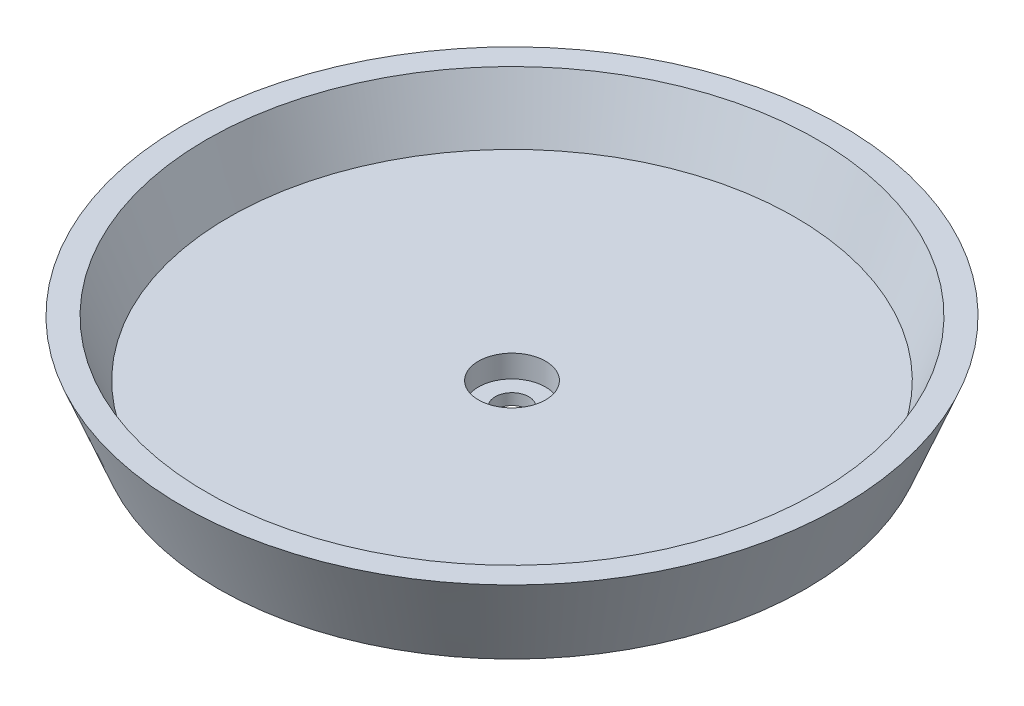
from build123d import *


with BuildPart() as part:
    # 草图1 → 旋转1 (revolve)
    with BuildSketch(Plane.XY):
        Polygon((-41.877397163, 8.47616959), (-43.877397163, 13.47616959), (-46.031463086, 13.47616959), (-42.831463086, 5.47616959), (-18.077397163, 5.47616959), (-18.077397163, 6.47616959), (-19.577397163, 6.47616959), (-19.577397163, 8.47616959), align=None)
    revolve(axis=Axis((-16.577397163, 5.47616959, 0), (0, 1, 0)))


solid = part.part
